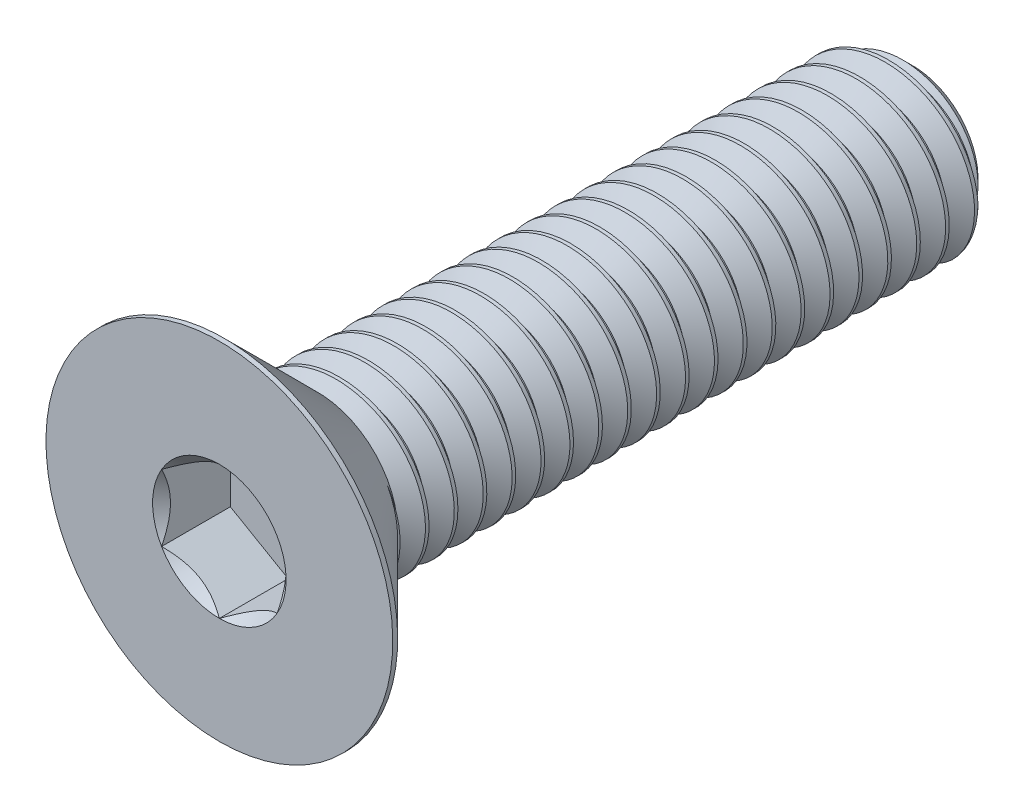
from build123d import *

# Parameters (mm, degrees)
CHAMFER1_SIZE      = 0.375
CUT_EXTRUDE2_DEPTH = 1.19
CUT_SWEEP1_PITCH   = 0.5


with BuildPart() as part:
    # Sketch1 → Revolve1 (revolve)
    with BuildSketch(Plane(origin=(0, 0, 0), x_dir=(0, 0, -1), z_dir=(1, 0, 0)), mode=Mode.PRIVATE) as revolve1_sk:
        Polygon((-4.3, 1.5), (6, 1.5), (6, 0), (-4.81, 0), (-4.81, 1.5), align=None)
    revolve(revolve1_sk.sketch.rotate(Axis((0, 0, 4.81), (0, 0, -1)), 180), axis=Axis((0, 0, 4.81), (0, 0, -1)))

    # Chamfer1
    chamfer1_edges = [part.edges().sort_by_distance(p)[0] for p in [
        (0, 1.5, -6),
    ]]
    chamfer(chamfer1_edges, length=CHAMFER1_SIZE)

    # Cut-Sweep1: the profile of Sketch13 screwed along a right-hand helix of 24 turns, 6 arcs to a turn; built about Z, then put on its axis
    cut_sweep1_z = Axis((0, 0, 0), (0, 0, 1))
    cut_sweep1_corners = [(1.527063294, 0, 0.015625), (1.527063294, 0, -0.453125), (1.175240474, 0, -0.25), (1.175240474, 0, -0.1875)]
    with BuildLine(mode=Mode.PRIVATE) as cut_sweep1_profile:
        Line(cut_sweep1_corners[0], cut_sweep1_corners[1])
        Line(cut_sweep1_corners[1], cut_sweep1_corners[2])
        Line(cut_sweep1_corners[2], cut_sweep1_corners[3])
        Line(cut_sweep1_corners[3], cut_sweep1_corners[0])
    cut_sweep1_cap = Face(cut_sweep1_profile.wire())
    cut_sweep1_turn_angles = [0, 30, 60, 90, 120, 150, 180, 210, 240, 270, 300, 330, 360]
    cut_sweep1_turn_weights = [1, 0.8660254037844387, 1, 0.8660254037844387, 1, 0.8660254037844387, 1, 0.8660254037844387, 1, 0.8660254037844387, 1, 0.8660254037844387, 1]
    cut_sweep1_turn_rails = [Edge.make_bspline([Vector(p[0], p[1], 0).rotate(cut_sweep1_z, cut_sweep1_turn_angles[k]) / cut_sweep1_turn_weights[k] + Vector(0, 0, p[2] + CUT_SWEEP1_PITCH * cut_sweep1_turn_angles[k] / 360) for k in range(13)], [0, 0, 0, 1, 1, 2, 2, 3, 3, 4, 4, 5, 5, 6, 6, 6], 2, cut_sweep1_turn_weights) for p in cut_sweep1_corners]
    cut_sweep1_turn_sides = [Face.make_surface_from_curves(cut_sweep1_turn_rails[p[0]], cut_sweep1_turn_rails[p[1]]) for p in [(0, 1), (1, 2), (2, 3), (3, 0)]]
    cut_sweep1 = Plane(origin=(0, 0, -6), x_dir=(0, 1, 0), z_dir=(0, 0, 1)) * Solid(Shell([*[p.moved(Location((0, 0, CUT_SWEEP1_PITCH * i))) for i in range(24) for p in cut_sweep1_turn_sides], cut_sweep1_cap, cut_sweep1_cap.rotate(cut_sweep1_z, 8640).moved(Location((0, 0, CUT_SWEEP1_PITCH * 8640 / 360)))]))
    add(cut_sweep1, mode=Mode.SUBTRACT)


with BuildPart() as body_2:
    # Sketch7 → Revolve2 (revolve)
    with BuildSketch(Plane(origin=(0, 0, 0), x_dir=(0, 0, -1), z_dir=(1, 0, 0)), mode=Mode.PRIVATE) as revolve2_sk:
        Polygon((-6, 3), (-5.915, 3), (-4.3, 1.385), (-4.3, 0), (-6, 0), align=None)
    revolve(revolve2_sk.sketch.rotate(Axis((0, 0, 6), (0, 0, -1)), 180), axis=Axis((0, 0, 6), (0, 0, -1)))

    # Sketch5 → Cut-Extrude2 (cut)
    with BuildSketch(Plane.XY.offset(6)):
        Polygon((1, -0.577350269), (1, 0.577350269), (0, 1.154700538), (-1, 0.577350269), (-1, -0.577350269), (0, -1.154700538), align=None)
    extrude(amount=-CUT_EXTRUDE2_DEPTH, mode=Mode.SUBTRACT)

    # Cut-Extrude3 cone 1 section (through the dimple's axis) → Cut-Extrude3 (revolve, cut)
    with BuildSketch(Plane(origin=(0, 0, 6), x_dir=(0, -1, 0), z_dir=(1, 0, 0))):
        Polygon((0, 0), (1.154700538, 0), (0, 1.154700538), align=None)
    revolve(axis=Axis((0, 0, 6), (0, 0, -1)), mode=Mode.SUBTRACT)

    # Combine1: union part
    add(part.part)


solid = body_2.part
